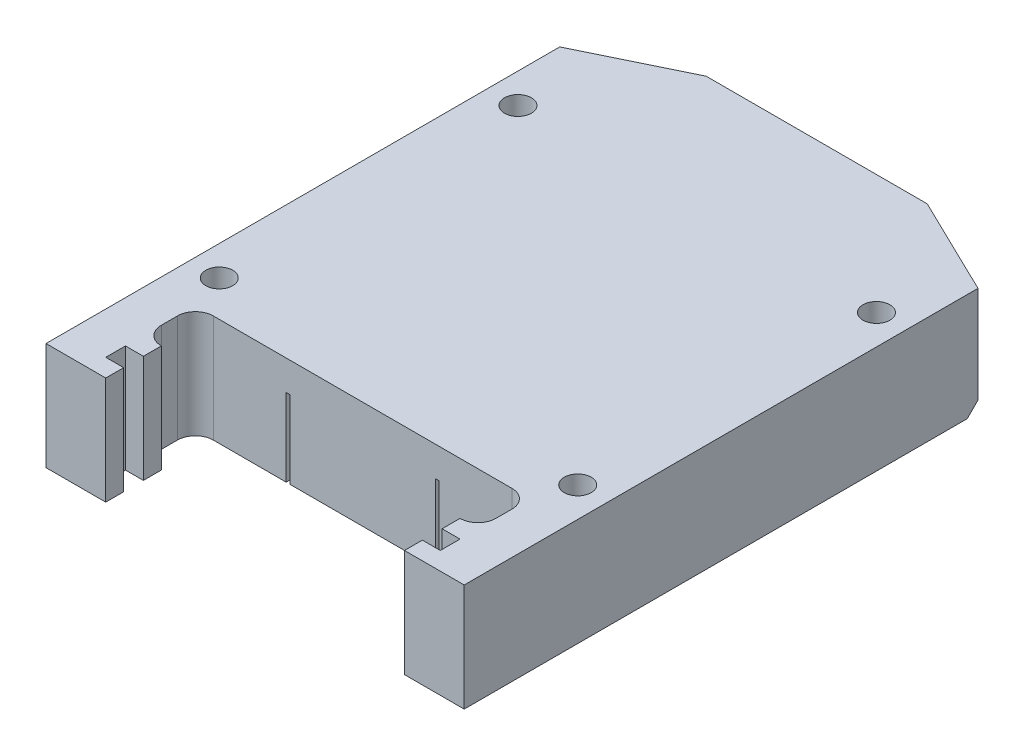
from build123d import *

# Parameters (mm, degrees)
SKETCH_1_W                = 70
SKETCH_1_H                = 18
EXTRUDE_1_DEPTH           = 60
CUT_EXTRUDE_1_DEPTH       = 94.936148527
SKETCH_3_W                = 15
SKETCH_3_H                = 5
CUT_EXTRUDE_2_DEPTH       = 1
SKETCH_4_W                = 15
SKETCH_4_H                = 5
CUT_EXTRUDE_3_DEPTH       = 1
SKETCH_5_W                = 3
SKETCH_5_H                = 11
CUT_EXTRUDE_4_DEPTH       = 1
SKETCH_6_W                = 3
SKETCH_6_H                = 11
CUT_EXTRUDE_5_DEPTH       = 1
CHAMFER_1_SIZE            = 1
EXTRUDE_9_DEPTH           = 6
SKETCH_7_W                = 29.5
SKETCH_7_H                = 9
CUT_EXTRUDE_7_DEPTH       = 4
SKETCH_9_W                = 37
SKETCH_9_H                = 7.5
EXTRUDE_3_DEPTH           = 12
SKETCH_10_W               = 70
SKETCH_10_H               = 18
EXTRUDE_4_DEPTH           = 8
CHAMFER_4_SIZE            = 4
SKETCH_11_W               = 8
SKETCH_11_H               = 11
CUT_EXTRUDE_8_DEPTH       = 3
SKETCH_12_W               = 0.6
SKETCH_12_H               = 33.5
CUT_EXTRUDE_9_DEPTH       = 13
SKETCH_13_W               = 0.6
SKETCH_13_H               = 52.5
EXTRUDE_5_DEPTH           = 7
SKETCH_14_W               = 0.6
SKETCH_14_H               = 10
EXTRUDE_6_DEPTH           = 1
SKETCH_15_W               = 7.7
SKETCH_15_H               = 49
EXTRUDE_7_DEPTH           = 0.6
SKETCH_18_W               = 7.7
SKETCH_18_H               = 10
EXTRUDE_8_DEPTH           = 0.6
CHAMFER_5_SIZE            = 1.8
SKETCH_22_W               = 3
SKETCH_22_H               = 6.5
CUT_EXTRUDE_10_DEPTH      = 1
EXTRUDE_10_DEPTH          = 18
FILLET_1_R                = 3
HOLE_WIZARD_2_D           = 4.5
HOLE_WIZARD_2_CSINK_D     = 8.6
HOLE_WIZARD_2_CSINK_ANGLE = 90


with BuildPart() as part:
    # 草图1 → 凸台-拉伸1 (new body)
    with BuildSketch(Plane.XY):
        with Locations((35, 9)):
            Rectangle(SKETCH_1_W, SKETCH_1_H)
    extrude(amount=EXTRUDE_1_DEPTH)

    # 草图2 → 切除-拉伸1 (cut, through all)
    with BuildSketch(Plane.XY.offset(60)):
        Polygon((13.4, 0), (13.4, 5), (9.4, 5), (9.4, 12), (60.6, 12), (60.6, 5), (56.6, 5), (56.6, 0), align=None)
    extrude(amount=-CUT_EXTRUDE_1_DEPTH, mode=Mode.SUBTRACT)

    # 草图3 → 切除-拉伸2 (cut)
    with BuildSketch(Plane(origin=(13.4, 0, 0), x_dir=(0, 0, -1), z_dir=(1, 0, 0))):
        with Locations((-7.5, 2.5)):
            Rectangle(SKETCH_3_W, SKETCH_3_H)
    extrude(amount=-CUT_EXTRUDE_2_DEPTH, mode=Mode.SUBTRACT)

    # 草图4 → 切除-拉伸3 (cut)
    with BuildSketch(Plane.ZY.offset(-56.6)):
        with Locations((7.5, 2.5)):
            Rectangle(SKETCH_4_W, SKETCH_4_H)
    extrude(amount=-CUT_EXTRUDE_3_DEPTH, mode=Mode.SUBTRACT)

    # 草图5 → 切除-拉伸4 (cut)
    with BuildSketch(Plane(origin=(0, 5, 0), x_dir=(1, 0, 0), z_dir=(0, 1, 0))):
        with Locations((59.1, -5.5)):
            Rectangle(SKETCH_5_W, SKETCH_5_H)
    extrude(amount=-CUT_EXTRUDE_4_DEPTH, mode=Mode.SUBTRACT)

    # 草图6 → 切除-拉伸5 (cut)
    with BuildSketch(Plane(origin=(0, 5, 0), x_dir=(1, 0, 0), z_dir=(0, 1, 0))):
        with Locations((10.9, -5.5)):
            Rectangle(SKETCH_6_W, SKETCH_6_H)
    extrude(amount=-CUT_EXTRUDE_5_DEPTH, mode=Mode.SUBTRACT)

    # 倒角1
    chamfer_1_edges = [part.edges().sort_by_distance(p)[0] for p in [
        (59.1, 4, 11),
        (10.9, 4, 11),
        (12.4, 2.5, 15),
        (57.6, 2.5, 15),
    ]]
    chamfer(chamfer_1_edges, length=CHAMFER_1_SIZE - 0.0001)  # a hair under: the kernel refuses the full size

    # 草图21 → 凸台-拉伸9 (add)
    with BuildSketch(Plane(origin=(0, 18, 0), x_dir=(1, 0, 0), z_dir=(0, 1, 0))):
        Polygon((0, 0), (16.5, 8), (53.5, 8), (70, 0), align=None)
    extrude(amount=-EXTRUDE_9_DEPTH)

    # 草图7 → 切除-拉伸7 (cut)
    with BuildSketch(Plane.XZ.offset(-12)):
        with Locations((35, 0.5)):
            Rectangle(SKETCH_7_W, SKETCH_7_H)
    extrude(amount=-CUT_EXTRUDE_7_DEPTH, mode=Mode.SUBTRACT)

    # 草图9 → 凸台-拉伸3 (add)
    with BuildSketch(Plane.XZ.offset(-12)):
        with Locations((35, 56.25)):
            Rectangle(SKETCH_9_W, SKETCH_9_H)
    extrude(amount=EXTRUDE_3_DEPTH)

    # 草图10 → 凸台-拉伸4 (add)
    with BuildSketch(Plane.XY.offset(60)):
        with Locations((35, 9)):
            Rectangle(SKETCH_10_W, SKETCH_10_H)
    extrude(amount=EXTRUDE_4_DEPTH)

    # 倒角4
    chamfer_4_edges = [part.edges().sort_by_distance(p)[0] for p in [
        (35, 16, 5),
    ]]
    chamfer(chamfer_4_edges, length=CHAMFER_4_SIZE - 0.0001)  # a hair under: the kernel refuses the full size

    # 草图11 → 切除-拉伸8 (cut)
    with BuildSketch(Plane.XZ):
        with Locations((35, 58)):
            Rectangle(SKETCH_11_W, SKETCH_11_H)
    extrude(amount=-CUT_EXTRUDE_8_DEPTH, mode=Mode.SUBTRACT)

    # 草图12 → 切除-拉伸9 (cut)
    with BuildSketch(Plane.XZ):
        with Locations((22.5, 51.25)):
            Rectangle(SKETCH_12_W, SKETCH_12_H)
        with Locations((47.5, 51.25)):
            Rectangle(SKETCH_12_W, SKETCH_12_H)
    extrude(amount=-CUT_EXTRUDE_9_DEPTH, mode=Mode.SUBTRACT)

    # 草图13 → 凸台-拉伸5 (add)
    with BuildSketch(Plane.XZ.offset(-12)):
        with Locations((16.8, 26.25)):
            Rectangle(SKETCH_13_W, SKETCH_13_H)
        with Locations((53.2, 26.25)):
            Rectangle(SKETCH_13_W, SKETCH_13_H)
    extrude(amount=EXTRUDE_5_DEPTH)

    # 草图14 → 凸台-拉伸6 (add)
    with BuildSketch(Plane.XZ.offset(-5)):
        with Locations((16.8, 5)):
            Rectangle(SKETCH_14_W, SKETCH_14_H)
        with Locations((53.2, 5)):
            Rectangle(SKETCH_14_W, SKETCH_14_H)
    extrude(amount=EXTRUDE_6_DEPTH)

    # 草图15 → 凸台-拉伸7 (add)
    with BuildSketch(Plane.XZ.offset(-5)):
        with Locations((13.25, 35.5)):
            Rectangle(SKETCH_15_W, SKETCH_15_H)
        with Locations((56.75, 35.5)):
            Rectangle(SKETCH_15_W, SKETCH_15_H)
    extrude(amount=EXTRUDE_7_DEPTH)

    # 草图18 → 凸台-拉伸8 (add)
    with BuildSketch(Plane.XZ.offset(-4)):
        with Locations((13.25, 5)):
            Rectangle(SKETCH_18_W, SKETCH_18_H)
        with Locations((56.75, 5)):
            Rectangle(SKETCH_18_W, SKETCH_18_H)
    extrude(amount=EXTRUDE_8_DEPTH)

    # 倒角5
    chamfer_5_edges = [part.edges().sort_by_distance(p)[0] for p in [
        (35, 12, -8),
        (9.4, 12, 30),
        (60.6, 12, 30),
        (6.2, 0, 0),
        (63.8, 0, 0),
    ]]
    chamfer(chamfer_5_edges, length=CHAMFER_5_SIZE)

    # 草图22 → 切除-拉伸10 (cut)
    with BuildSketch(Plane.XZ):
        with Locations((24.3, 60.75)):
            Rectangle(SKETCH_22_W, SKETCH_22_H)
        with Locations((45.7, 60.75)):
            Rectangle(SKETCH_22_W, SKETCH_22_H)
    extrude(amount=-CUT_EXTRUDE_10_DEPTH, mode=Mode.SUBTRACT)

    # 草图23 → 凸台-拉伸10 (add)
    with BuildSketch(Plane(origin=(0, 18, 0), x_dir=(1, 0, 0), z_dir=(0, 1, 0))):
        Polygon((0, -68), (0, -86), (10, -86), (10, -83), (7, -83), (7, -79.7), (10, -79.7), (10, -76.7), (7, -76.7), (7, -68), align=None)
        Polygon((63, -68), (70, -68), (70, -86), (60, -86), (60, -83), (63, -83), (63, -79.7), (60, -79.7), (60, -76.7), (63, -76.7), align=None)
    extrude(amount=-EXTRUDE_10_DEPTH)

    # 圆角1
    fillet_1_edges = [part.edges().sort_by_distance(p)[0] for p in [
        (7, 9, 76.7),
        (7, 9, 68),
        (63, 9, 68),
        (63, 9, 76.7),
    ]]
    fillet(fillet_1_edges, radius=FILLET_1_R - 0.0001)  # a hair under: the kernel refuses the full size

    # 打孔尺寸(%根据十字)槽半沉头木螺钉的类型2 (through all)
    with Locations(Plane(origin=(0, 0, 0), x_dir=(-1, 0, 0), z_dir=(0, -1, 0))):
        with Locations((-65, -12), (-65, -62), (-5, -12), (-5, -62)):
            CounterSinkHole(HOLE_WIZARD_2_D / 2, HOLE_WIZARD_2_CSINK_D / 2, counter_sink_angle=HOLE_WIZARD_2_CSINK_ANGLE)


solid = part.part
